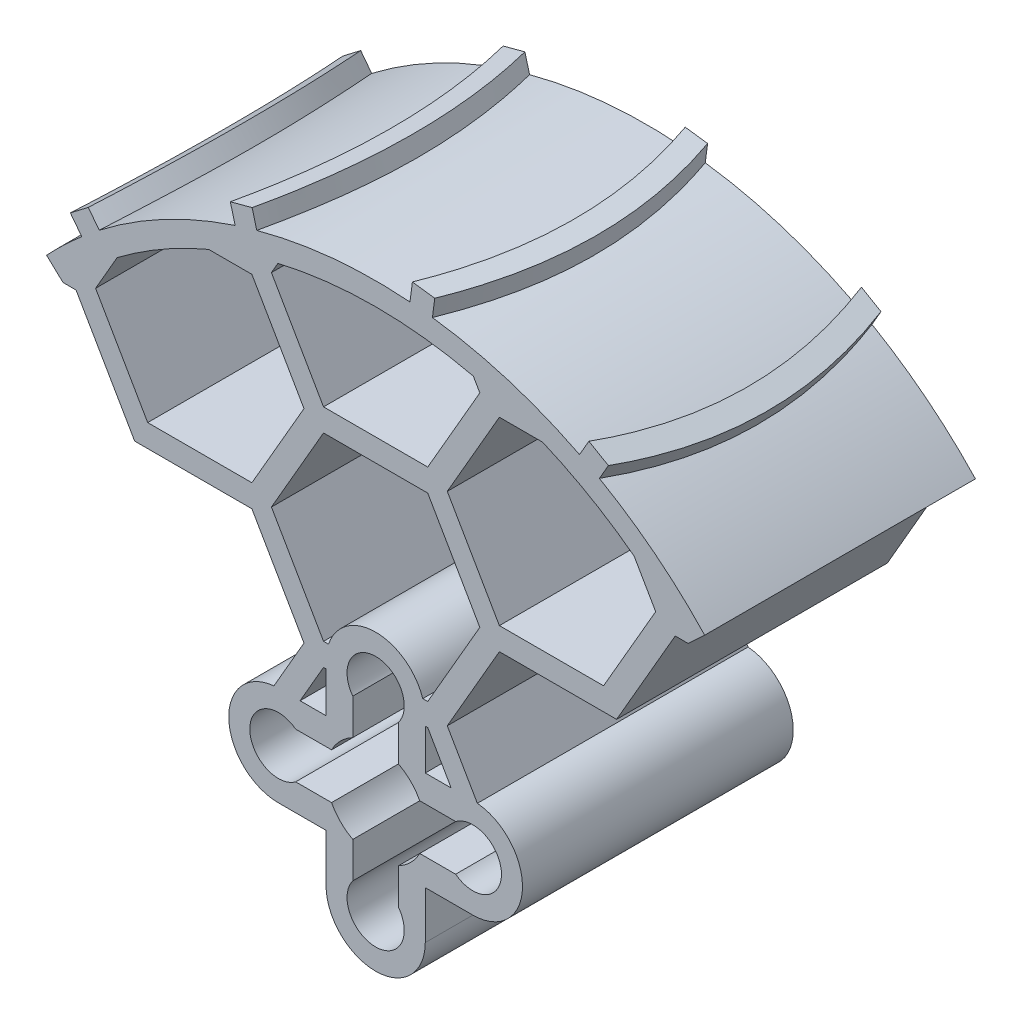
from build123d import *

# Parameters (mm, degrees)
BOSS_EXTRUDE1_DEPTH = 60
SKETCH1_4_R         = 6.338999997
SKETCH1_4_R_2       = 3.302
SKETCH1_4_R_3       = 3.301999997
BOSS_EXTRUDE2_DEPTH = 10
SKETCH1_6_R         = 6.338999997
SKETCH1_6_R_2       = 3.301999997
SKETCH1_6_R_3       = 3.302
BOSS_EXTRUDE4_DEPTH = 30
BOSS_EXTRUDE5_DEPTH = 60
BOSS_EXTRUDE6_START = -2
BOSS_EXTRUDE6_DEPTH = 6
CIRPATTERN3_COUNT   = 16


# Read off the part's stored shape, not the designer's step: Boss-Extrude1
with BuildPart() as part:
    # Boss-Extrude1 outline → Boss-Extrude1 (new body)
    with BuildSketch(Plane.XY):
        with BuildLine():
            Line((-27.424137764, 42.49999995), (-15.877132386, 22.499999959))
            Line((-15.877132386, 22.499999959), (-22.542678391, 10.954935617))
            ThreePointArc((-22.542678391, 10.954935617), (-32.536728065, -0.49784941), (-21.547999925, -11.00000003))
            Line((-21.547999925, -11.00000003), (-10.999999983, -11.00000003))
            Line((-10.999999983, -11.00000003), (-10.999999983, -21.547999949))
            ThreePointArc((-10.999999983, -21.547999949), (2.4e-08, -32.547999956), (11.00000003, -21.547999949))
            Line((11.00000003, -21.547999949), (11.00000003, -11.000000006))
            Line((11.00000003, -11.000000006), (21.547999949, -11.000000006))
            ThreePointArc((21.547999949, -11.000000006), (32.53672809, -0.497849376), (22.542678394, 10.954935643))
            Line((22.542678394, 10.954935643), (15.877132386, 22.499999959))
            Line((15.877132386, 22.499999959), (27.424137764, 42.49999995))
            Line((27.424137764, 42.49999995), (53.404899911, 42.49999995))
            Line((53.404899911, 42.49999995), (66.39528096, 64.999999935))
            Line((66.39528096, 64.999999935), (69.282032276, 65.000000028))
            ThreePointArc((69.282032276, 65.000000028), (63.510032668, 70.650376861), (57.278911905, 75.79001419))
            Line((57.278911905, 75.79001419), (62.0651539, 67.499999879))
            Line((62.0651539, 67.499999879), (50.518148521, 47.499999888))
            Line((50.518148521, 47.499999888), (27.42413776, 47.499999896))
            Line((27.42413776, 47.499999896), (15.877132386, 67.499999879))
            Line((15.877132386, 67.499999879), (27.424137764, 87.49999987))
            Line((27.424137764, 87.49999987), (36.996621947, 87.499999797))
            ThreePointArc((36.996621947, 87.499999797), (29.430004911, 90.326490085), (21.650635056, 92.500000009))
            Line((21.650635056, 92.500000009), (23.094010837, 89.999999729))
            Line((23.094010837, 89.999999729), (11.547005507, 69.999999822))
            Line((11.547005507, 69.999999822), (-11.547004687, 69.999999822))
            Line((-11.547004687, 69.999999822), (-23.094010614, 89.999999911))
            Line((-23.094010614, 89.999999911), (-21.650634856, 92.500000056))
            ThreePointArc((-21.650634856, 92.500000056), (-29.430004813, 90.326490116), (-36.996621947, 87.499999797))
            Line((-36.996621947, 87.499999797), (-27.424137764, 87.49999987))
            Line((-27.424137764, 87.49999987), (-15.877132386, 67.499999879))
            Line((-15.877132386, 67.499999879), (-27.424137764, 47.499999888))
            Line((-27.424137764, 47.499999888), (-50.518148521, 47.499999888))
            Line((-50.518148521, 47.499999888), (-62.0651539, 67.499999879))
            Line((-62.0651539, 67.499999879), (-57.278911905, 75.79001419))
            ThreePointArc((-57.278911905, 75.79001419), (-63.510032668, 70.650376861), (-69.282032276, 65.000000028))
            Line((-69.282032276, 65.000000028), (-66.39528096, 64.999999935))
            Line((-66.39528096, 64.999999935), (-53.404899911, 42.49999995))
            Line((-53.404899911, 42.49999995), (-27.424137764, 42.49999995))
        make_face()
        Polygon((-11.000000006, 19.999999941), (-11.000000006, 10.999999983), (-16.743157748, 10.999999983), (-11.54700535, 19.999999941), align=None, mode=Mode.SUBTRACT)
        with BuildLine():
            Line((-9.767988869, -5.058299477), (-17.727459778, -5.058299515))
            ThreePointArc((-17.727459778, -5.058299515), (-27.88699994, -4.1e-08), (-17.727459815, 5.058299508))
            Line((-17.727459815, 5.058299508), (-9.767988835, 5.058299543))
            ThreePointArc((-9.767988835, 5.058299543), (-7.778174571, 7.778174624), (-5.058299477, 9.767988869))
            Line((-5.058299477, 9.767988869), (-5.058299513, 17.727459781))
            ThreePointArc((-5.058299513, 17.727459781), (-1.2e-08, 27.886999922), (5.058299528, 17.7274598))
            Line((5.058299528, 17.7274598), (5.058299543, 9.767988835))
            ThreePointArc((5.058299543, 9.767988835), (7.778174624, 7.778174571), (9.767988869, 5.058299477))
            Line((9.767988869, 5.058299477), (17.727459795, 5.058299493))
            ThreePointArc((17.727459795, 5.058299493), (27.88699994, -1.5e-08), (17.727459798, -5.05829953))
            Line((17.727459798, -5.05829953), (9.767988835, -5.058299543))
            ThreePointArc((9.767988835, -5.058299543), (7.778174571, -7.778174624), (5.058299477, -9.767988869))
            Line((5.058299477, -9.767988869), (5.058299496, -17.727459793))
            ThreePointArc((5.058299496, -17.727459793), (1.3e-08, -27.886999957), (-5.058299511, -17.727459813))
            Line((-5.058299511, -17.727459813), (-5.058299543, -9.767988835))
            ThreePointArc((-5.058299543, -9.767988835), (-7.778174624, -7.778174571), (-9.767988869, -5.058299477))
        make_face(mode=Mode.SUBTRACT)
        Polygon((16.743157694, 11.000000006), (11.000000006, 11.000000006), (11.000000006, 19.999999941), (11.54700535, 19.999999941), align=None, mode=Mode.SUBTRACT)
        with BuildLine():
            Line((23.094010708, 44.999999885), (11.547005356, 24.999999941))
            Line((11.547005356, 24.999999941), (10.444314053, 24.999999941))
            ThreePointArc((10.444314053, 24.999999941), (0, 32.547999932), (-10.444314053, 24.999999941))
            Line((-10.444314053, 24.999999941), (-11.547005099, 24.999999941))
            Line((-11.547005099, 24.999999941), (-23.094010665, 44.999999941))
            Line((-23.094010665, 44.999999941), (-11.54700535, 64.999999822))
            Line((-11.54700535, 64.999999822), (11.54700535, 64.999999822))
            Line((11.54700535, 64.999999822), (23.094010708, 44.999999885))
        make_face(mode=Mode.SUBTRACT)
    extrude(amount=BOSS_EXTRUDE1_DEPTH)

    # Sketch1<4> → Boss-Extrude2 (add)
    # profile 1 of 4: a face of its own
    with BuildSketch(Plane.XY):
        with Locations((0, 21.547999925)):
            Circle(SKETCH1_4_R)
        with Locations((0, 21.547999925)):
            Circle(SKETCH1_4_R_2, mode=Mode.SUBTRACT)
    # profile 2 of 4: a face of its own
    with BuildSketch(Plane.XY):
        with Locations((21.547999943, -1.7e-08)):
            Circle(SKETCH1_4_R)
        with Locations((21.547999974, -2.6e-08)):
            Circle(SKETCH1_4_R_2, mode=Mode.SUBTRACT)
    # profile 3 of 4: a face of its own
    with BuildSketch(Plane.XY):
        with Locations((-21.547999943, -1.7e-08)):
            Circle(SKETCH1_4_R)
        with Locations((-21.547999951, -4.8e-08)):
            Circle(SKETCH1_4_R_2, mode=Mode.SUBTRACT)
    # profile 4 of 4: a face of its own
    with BuildSketch(Plane.XY):
        with Locations((0, -21.54799996)):
            Circle(SKETCH1_4_R)
        with Locations((2.3e-08, -21.547999999)):
            Circle(SKETCH1_4_R_3, mode=Mode.SUBTRACT)
    extrude(amount=BOSS_EXTRUDE2_DEPTH)

    # Sketch1<6> → Boss-Extrude4 (add)
    # profile 1 of 4: a face of its own
    with BuildSketch(Plane.XY):
        with Locations((0, -21.54799996)):
            Circle(SKETCH1_6_R)
        with Locations((2.3e-08, -21.547999999)):
            Circle(SKETCH1_6_R_2, mode=Mode.SUBTRACT)
    # profile 2 of 4: a face of its own
    with BuildSketch(Plane.XY):
        with Locations((-21.547999943, -1.7e-08)):
            Circle(SKETCH1_6_R)
        with Locations((-21.547999951, -4.8e-08)):
            Circle(SKETCH1_6_R_3, mode=Mode.SUBTRACT)
    # profile 3 of 4: a face of its own
    with BuildSketch(Plane.XY):
        with Locations((21.547999943, -1.7e-08)):
            Circle(SKETCH1_6_R)
        with Locations((21.547999974, -2.6e-08)):
            Circle(SKETCH1_6_R_3, mode=Mode.SUBTRACT)
    # profile 4 of 4: a face of its own
    with BuildSketch(Plane.XY):
        with Locations((0, 21.547999925)):
            Circle(SKETCH1_6_R)
        with Locations((0, 21.547999925)):
            Circle(SKETCH1_6_R_3, mode=Mode.SUBTRACT)
    extrude(amount=BOSS_EXTRUDE4_DEPTH)

    # Sketch1<7> → Boss-Extrude5 (add)
    with BuildSketch(Plane.XY):
        with BuildLine():
            Line((-69.282032276, 65.000000028), (-72.928455025, 68.421052659))
            ThreePointArc((-72.928455025, 68.421052659), (0, 99.999999996), (72.928455025, 68.421052659))
            Line((72.928455025, 68.421052659), (69.282032276, 65.000000028))
            ThreePointArc((69.282032276, 65.000000028), (0, 95), (-69.282032276, 65.000000028))
        make_face()
    extrude(amount=BOSS_EXTRUDE5_DEPTH)

    # Sketch2 → Boss-Extrude6 (add)
    with BuildSketch(Plane(origin=(49.999999998, 86.602540375, 0), x_dir=(0.866025403784439, -0.4999999999999993, 0), z_dir=(0.4999999999999993, 0.866025403784439, 0)).offset(BOSS_EXTRUDE6_START)):
        with BuildLine():
            Line((0, 0), (-5, 0))
            add(Edge.make_bspline(
                [(-5, 0), (4.762549661, -30.076815137), (-5.473720523, -60)],
                knots=[0, 0, 0, 1, 1, 1], degree=2))
            Line((-5.473720523, -60), (-0.473720523, -60))
            add(Edge.make_bspline(
                [(0, 0), (9.762549647, -30.076815137), (-0.473720523, -60)],
                knots=[0, 0, 0, 1, 1, 1], degree=2))
        make_face()
    boss_extrude6 = extrude(amount=BOSS_EXTRUDE6_DEPTH)

    # CirPattern3: Boss-Extrude6 ×16 about axis, 12 skipped
    cirpattern3_axis = Axis((0, 0, 0), (0, 0, -1))
    add([boss_extrude6.rotate(cirpattern3_axis, i * 360 / CIRPATTERN3_COUNT) for i in range(1, CIRPATTERN3_COUNT) if i not in (1, 2, 3, 4, 5, 6, 7, 8, 9, 10, 11, 12)])


solid = part.part
